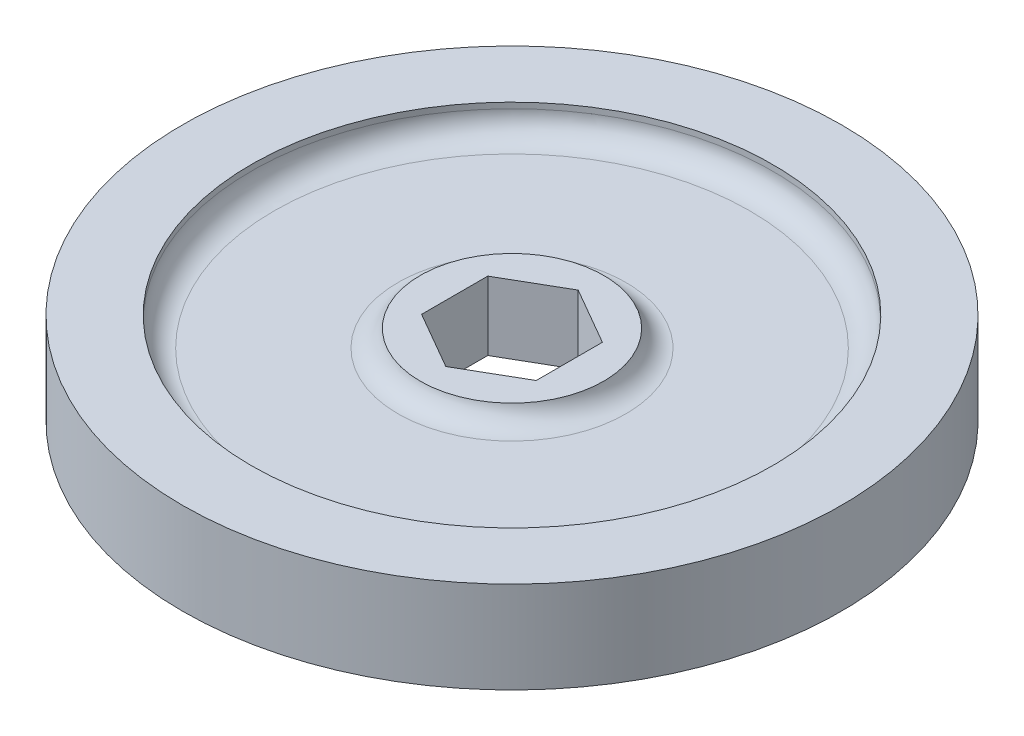
from build123d import *

# Parameters (mm, degrees)
BOSS_EXTRUDE1_DEPTH      = 3.81
BOSS_EXTRUDE1_DEPTH_BACK = 3.81
SKETCH1_R                = 10.16
BOSS_EXTRUDE2_DEPTH      = 1.905
BOSS_EXTRUDE2_DEPTH_BACK = 1.905
SKETCH1_3_R              = 28.8925
SKETCH1_3_R_2            = 10.16
BOSS_EXTRUDE3_DEPTH      = 5.08
BOSS_EXTRUDE3_DEPTH_BACK = 5.08
SKETCH1_4_R              = 31.4325
SKETCH1_4_R_2            = 28.8925
BOSS_EXTRUDE4_DEPTH      = 5.08
BOSS_EXTRUDE4_DEPTH_BACK = 5.08
SKETCH1_5_R              = 36.5125
SKETCH1_5_R_2            = 31.4325
FILLET1_R                = 2.54


with BuildPart() as part:
    # Sketch1 → Boss-Extrude1 (new, two sides: drawn at the far end of the back side and taken through both)
    with BuildSketch(Plane(origin=(0, 0, 0), x_dir=(1, 0, 0), z_dir=(0, 1, 0)).offset(-BOSS_EXTRUDE1_DEPTH_BACK)):
        with Locations(Location((0, 0, 0), (0, 0, 270))):
            Circle(SKETCH1_R)
        Polygon((6.35, 3.666174209), (0, 7.332348419), (-6.35, 3.666174209), (-6.35, -3.666174209), (0, -7.332348419), (6.35, -3.666174209), align=None, mode=Mode.SUBTRACT)
    extrude(amount=BOSS_EXTRUDE1_DEPTH + BOSS_EXTRUDE1_DEPTH_BACK)

    # Sketch1<3> → Boss-Extrude2 (add, two sides: drawn at the far end of the back side and taken through both)
    with BuildSketch(Plane(origin=(0, 0, 0), x_dir=(1, 0, 0), z_dir=(0, 1, 0)).offset(-BOSS_EXTRUDE2_DEPTH_BACK)):
        with Locations(Location((0, 0, 0), (0, 0, 270))):
            Circle(SKETCH1_3_R)
        with Locations(Location((0, 0, 0), (0, 0, 270))):
            Circle(SKETCH1_3_R_2, mode=Mode.SUBTRACT)
    extrude(amount=BOSS_EXTRUDE2_DEPTH + BOSS_EXTRUDE2_DEPTH_BACK)

    # Sketch1<4> → Boss-Extrude3 (add, two sides: drawn at the far end of the back side and taken through both)
    with BuildSketch(Plane(origin=(0, 0, 0), x_dir=(1, 0, 0), z_dir=(0, 1, 0)).offset(-BOSS_EXTRUDE3_DEPTH_BACK)):
        with Locations(Location((0, 0, 0), (0, 0, 270))):
            Circle(SKETCH1_4_R)
        with Locations(Location((0, 0, 0), (0, 0, 270))):
            Circle(SKETCH1_4_R_2, mode=Mode.SUBTRACT)
    extrude(amount=BOSS_EXTRUDE3_DEPTH + BOSS_EXTRUDE3_DEPTH_BACK)

    # Sketch1<5> → Boss-Extrude4 (add, two sides: drawn at the far end of the back side and taken through both)
    with BuildSketch(Plane(origin=(0, 0, 0), x_dir=(1, 0, 0), z_dir=(0, 1, 0)).offset(-BOSS_EXTRUDE4_DEPTH_BACK)):
        with Locations(Location((0, 0, 0), (0, 0, 270))):
            Circle(SKETCH1_5_R)
        Circle(SKETCH1_5_R_2, mode=Mode.SUBTRACT)
    extrude(amount=BOSS_EXTRUDE4_DEPTH + BOSS_EXTRUDE4_DEPTH_BACK)

    # Fillet1
    # the kernel refuses this fillet: 2.54 mm, written as the material it adds along each edge
    with BuildSketch(Plane(origin=(0, 1.905, 0), x_dir=(0, 0, 1), z_dir=(-1, 0, 0))) as fillet1_piece_1:
        with BuildLine():
            CenterArc((12.619344425, 2.54), FILLET1_R, 194.477512186, 75.522487814)
            Line((12.619344425, 0), (12.619344425, -0.0508))
            Line((12.619344425, -0.0508), (10.16, -0.0508))
            Line((10.16, -0.0508), (10.1092, 0))
            ThreePointArc((10.1092, 0), (10.1092, 0.9525), (10.110813112, 1.8923))
            Line((10.110813112, 1.8923), (10.16, 1.905))
        make_face()
    revolve(axis=Axis((0, 1.905, 0), (0, 1, 0)))
    with BuildSketch(Plane(origin=(0, -1.905, 0), x_dir=(0, 0, 1), z_dir=(-1, 0, 0))) as fillet1_piece_2:
        with BuildLine():
            CenterArc((28.8925 - FILLET1_R, -FILLET1_R), FILLET1_R, 0, 90)
            Line((28.8925, -FILLET1_R), (28.8925 + FILLET1_R * 0.02, -FILLET1_R))
            Line((28.8925 + FILLET1_R * 0.02, -FILLET1_R), (28.8925 + FILLET1_R * 0.02, FILLET1_R * 0.02))
            Line((28.8925 + FILLET1_R * 0.02, FILLET1_R * 0.02), (28.8925 - FILLET1_R, FILLET1_R * 0.02))
            Line((28.8925 - FILLET1_R, FILLET1_R * 0.02), (28.8925 - FILLET1_R, 0))
        make_face()
    revolve(axis=Axis((0, -1.905, 0), (0, 1, 0)))
    with BuildSketch(Plane(origin=(0, -1.905, 0), x_dir=(0, 0, 1), z_dir=(-1, 0, 0))) as fillet1_piece_3:
        with BuildLine():
            CenterArc((12.619344425, -2.54), FILLET1_R, 90, 75.522487814)
            Line((12.619344425, 0), (12.619344425, 0.0508))
            Line((12.619344425, 0.0508), (10.16, 0.0508))
            Line((10.16, 0.0508), (10.1092, 0))
            ThreePointArc((10.1092, 0), (10.1092, -0.9525), (10.110813112, -1.8923))
            Line((10.110813112, -1.8923), (10.16, -1.905))
        make_face()
    revolve(axis=Axis((0, -1.905, 0), (0, 1, 0)))
    with BuildSketch(Plane(origin=(0, 1.905, 0), x_dir=(0, 0, 1), z_dir=(-1, 0, 0))) as fillet1_piece_4:
        with BuildLine():
            CenterArc((28.8925 - FILLET1_R, FILLET1_R), FILLET1_R, 270, 90)
            Line((28.8925 - FILLET1_R, 0), (28.8925 - FILLET1_R, -FILLET1_R * 0.02))
            Line((28.8925 - FILLET1_R, -FILLET1_R * 0.02), (28.8925 + FILLET1_R * 0.02, -FILLET1_R * 0.02))
            Line((28.8925 + FILLET1_R * 0.02, -FILLET1_R * 0.02), (28.8925 + FILLET1_R * 0.02, FILLET1_R))
            Line((28.8925 + FILLET1_R * 0.02, FILLET1_R), (28.8925, FILLET1_R))
        make_face()
    revolve(axis=Axis((0, 1.905, 0), (0, 1, 0)))


solid = part.part
